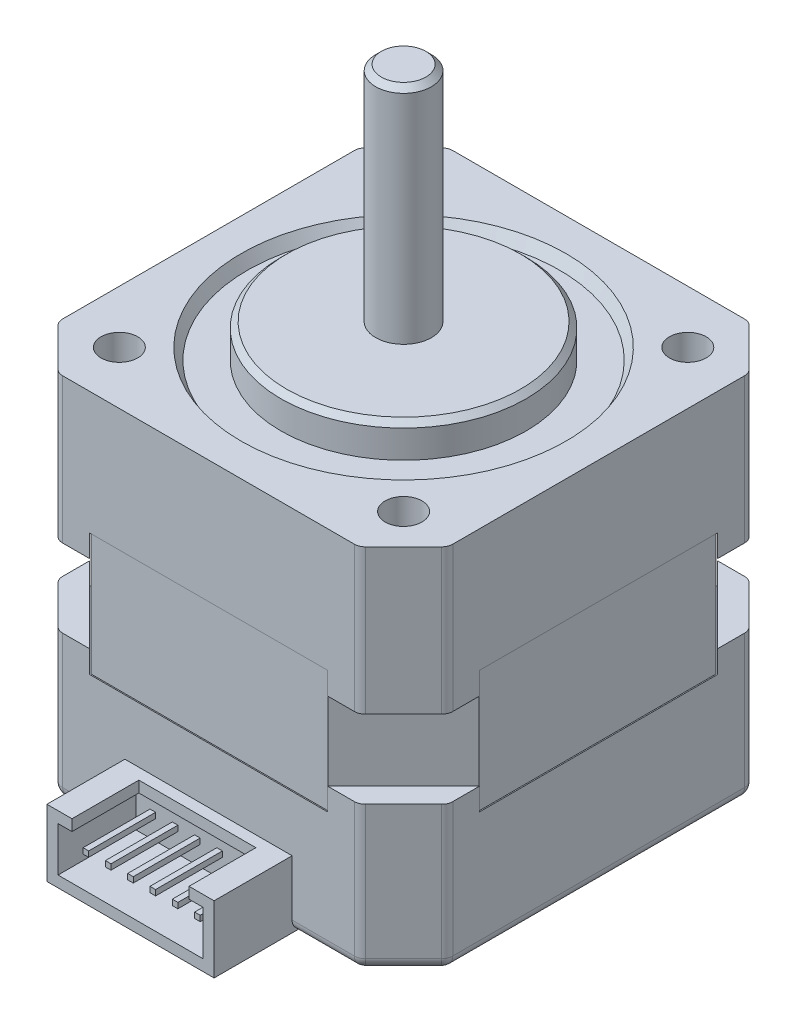
from build123d import *

# Parameters (mm, degrees)
EXTRUDE1_START       = -16.5
SKETCH1_W            = 35
SKETCH1_H            = 35
EXTRUDE1_DEPTH       = 11
CHAMFER3_SIZE        = 4
EXTRUDE2_DEPTH       = 2
BOSS_EXTRUDE2_DEPTH  = 5.5
MIRROR3_START        = 5.5
MIRROR3_DEPTH        = 11
MIRROR3_START_2      = 3.5
MIRROR3_2_DEPTH      = 2
SKETCH14_R           = 1.65
CUT_EXTRUDE4_DEPTH   = 12
FILLET3_R            = 1
SKETCH18_R           = 4.5
CUT_EXTRUDE6_DEPTH   = 2
SKETCH19_R           = 11
BOSS_EXTRUDE5_DEPTH  = 2
CHAMFER4_SIZE        = 0.5
FILLET7_R            = 1
SKETCH17_R           = 3.5
CUT_EXTRUDE7_DEPTH   = 2
CUT_EXTRUDE8_START   = -1
SKETCH20_R           = 14
SKETCH20_R_2         = 11
CUT_EXTRUDE8_DEPTH   = 1
DRAFT1_ANGLE         = 30
SKETCH22_R           = 2.75
BOSS_EXTRUDE6_DEPTH  = 2
FILLET8_R            = 1
SKETCH23_R           = 2.5
BOSS_EXTRUDE7_DEPTH  = 20
CHAMFER5_SIZE        = 0.5
SKETCH24_W           = 15
SKETCH24_H           = 6
SKETCH24_W_2         = 13
SKETCH24_H_2         = 4
BOSS_EXTRUDE10_DEPTH = 7
SKETCH25_W           = 0.5
SKETCH25_H           = 0.5
BOSS_EXTRUDE11_DEPTH = 6
SKETCH26_W           = 10.5
SKETCH26_H           = 1
CUT_EXTRUDE9_DEPTH   = 6


# Read off the part's stored shape, not the designer's step: Mirror3
with BuildPart() as part:
    # Sketch1 → Extrude1 (new body)
    with BuildSketch(Plane(origin=(0, 0, 0), x_dir=(1, 0, 0), z_dir=(0, 1, 0)).offset(EXTRUDE1_START)):
        Rectangle(SKETCH1_W, SKETCH1_H)
    extrude(amount=EXTRUDE1_DEPTH)

    # Chamfer3
    chamfer3_edges = [part.edges().sort_by_distance(p)[0] for p in [
        (-17.5, -11, -17.5),
        (17.5, -11, -17.5),
        (17.5, -11, 17.5),
        (-17.5, -11, 17.5),
    ]]
    chamfer(chamfer3_edges, length=CHAMFER3_SIZE)

    # Sketch2 → Extrude2 (add)
    with BuildSketch(Plane(origin=(0, -5.5, 0), x_dir=(-1, 0, 0), z_dir=(0, 1, 0))):
        Polygon((-17.5, -13.5), (-13.5, -17.5), (-10.671572875, -17.5), (-17.5, -10.671572875), align=None)
        Polygon((17.5, -13.5), (17.5, -10.671572875), (10.671572875, -17.5), (13.5, -17.5), align=None)
        Polygon((17.5, 13.5), (13.5, 17.5), (10.671572875, 17.5), (17.5, 10.671572875), align=None)
        Polygon((-17.5, 13.5), (-17.5, 10.671572875), (-10.671572875, 17.5), (-13.5, 17.5), align=None)
    extrude(amount=EXTRUDE2_DEPTH)

    # Sketch12 → Boss-Extrude2 (add, symmetric)
    with BuildSketch(Plane(origin=(0, 0, 0), x_dir=(1, 0, 0), z_dir=(0, 1, 0))):
        Polygon((-10.630151519, -17.4), (10.630151519, -17.4), (17.4, -10.630151519), (17.4, 10.630151519), (10.630151519, 17.4), (-10.630151519, 17.4), (-17.4, 10.630151519), (-17.4, -10.630151519), align=None)
    extrude(amount=BOSS_EXTRUDE2_DEPTH, both=True)

    # Mirror3 outline → Mirror3 (add)
    with BuildSketch(Plane(origin=(0, 0, 0), x_dir=(1, 0, 0), z_dir=(0, 1, 0)).offset(MIRROR3_START)):
        Polygon((-13.5, 17.5), (-17.5, 13.5), (-17.5, -13.5), (-13.5, -17.5), (13.5, -17.5), (17.5, -13.5), (17.5, 13.5), (13.5, 17.5), align=None)
    extrude(amount=MIRROR3_DEPTH)

    # Mirror3 2 outline → Mirror3 2 (add)
    with BuildSketch(Plane(origin=(0, 0, 0), x_dir=(1, 0, 0), z_dir=(0, 1, 0)).offset(MIRROR3_START_2)):
        Polygon((-13.5, 17.5), (-17.5, 13.5), (-17.5, 10.671572875), (-10.671572875, 17.5), align=None)
        Polygon((-10.671572875, -17.5), (-17.5, -10.671572875), (-17.5, -13.5), (-13.5, -17.5), align=None)
        Polygon((13.5, 17.5), (10.671572875, 17.5), (17.5, 10.671572875), (17.5, 13.5), align=None)
        Polygon((17.5, -10.671572875), (10.671572875, -17.5), (13.5, -17.5), (17.5, -13.5), align=None)
    extrude(amount=MIRROR3_2_DEPTH)

    # Sketch14 → Cut-Extrude4 (cut)
    with BuildSketch(Plane(origin=(0, 16.5, 0), x_dir=(1, 0, 0), z_dir=(0, 1, 0))):
        with Locations(Location((-12.75, 12.75, 0), (0, 0, 270))):
            Circle(SKETCH14_R)
        with Locations(Location((12.75, 12.75, 0), (0, 0, 270))):
            Circle(SKETCH14_R)
        with Locations(Location((12.75, -12.75, 0), (0, 0, 270))):
            Circle(SKETCH14_R)
        with Locations(Location((-12.75, -12.75, 0), (0, 0, 270))):
            Circle(SKETCH14_R)
    extrude(amount=-CUT_EXTRUDE4_DEPTH, mode=Mode.SUBTRACT)

    # Fillet3
    fillet3_edges = [part.edges().sort_by_distance(p)[0] for p in [
        (-13.5, 10, 17.5),
        (13.5, 10, 17.5),
        (17.5, 10, -13.5),
        (17.5, 10, 13.5),
        (-17.5, 10, -13.5),
        (-17.5, 10, 13.5),
        (-13.5, 10, -17.5),
        (13.5, 10, -17.5),
        (17.5, -10, -13.5),
        (17.5, -10, 13.5),
        (-13.5, -10, 17.5),
        (13.5, -10, 17.5),
        (-17.5, -10, -13.5),
        (-17.5, -10, 13.5),
        (-13.5, -10, -17.5),
        (13.5, -10, -17.5),
    ]]
    fillet(fillet3_edges, radius=FILLET3_R)

    # Sketch18 → Cut-Extrude6 (cut)
    with BuildSketch(Plane.XZ.offset(16.5)):
        with Locations(Location((0, 0, 0), (0, 0, 270))):
            Circle(SKETCH18_R)
    extrude(amount=-CUT_EXTRUDE6_DEPTH, mode=Mode.SUBTRACT)

    # Sketch19 → Boss-Extrude5 (add)
    with BuildSketch(Plane(origin=(0, 16.5, 0), x_dir=(1, 0, 0), z_dir=(0, 1, 0))):
        with Locations(Location((0, 0, 0), (0, 0, 90))):
            Circle(SKETCH19_R)
    extrude(amount=BOSS_EXTRUDE5_DEPTH)

    # Chamfer4
    chamfer4_edges = [part.edges().sort_by_distance(p)[0] for p in [
        (0, 18.5, 11),
    ]]
    chamfer(chamfer4_edges, length=CHAMFER4_SIZE)

    # Fillet7
    fillet7_edges = [part.edges().sort_by_distance(p)[0] for p in [
        (-17.5, -16.5, 0),
        (-15.5, -16.5, 15.5),
        (17.5, -16.5, 0),
        (15.5, -16.5, 15.5),
        (0, -16.5, 17.5),
        (-15.5, -16.5, -15.5),
        (0, -16.5, -17.5),
        (15.5, -16.5, -15.5),
        (-17.423879533, -16.5, -13.46846987),
        (-13.46846987, -16.5, -17.423879533),
        (13.46846987, -16.5, -17.423879533),
        (17.423879533, -16.5, -13.46846987),
        (17.423879533, -16.5, 13.46846987),
        (13.46846987, -16.5, 17.423879533),
        (-13.46846987, -16.5, 17.423879533),
        (-17.423879533, -16.5, 13.46846987),
    ]]
    fillet(fillet7_edges, radius=FILLET7_R)

    # Sketch17 → Cut-Extrude7 (cut)
    with BuildSketch(Plane.XZ.offset(16.5)):
        with Locations(Location((-12.75, 12.75, 0), (0, 0, 270))):
            Circle(SKETCH17_R)
        with Locations(Location((12.75, 12.75, 0), (0, 0, 270))):
            Circle(SKETCH17_R)
        with Locations(Location((12.75, -12.75, 0), (0, 0, 270))):
            Circle(SKETCH17_R)
        with Locations(Location((-12.75, -12.75, 0), (0, 0, 270))):
            Circle(SKETCH17_R)
    extrude(amount=-CUT_EXTRUDE7_DEPTH, mode=Mode.SUBTRACT)

    # Sketch20 → Cut-Extrude8 (cut)
    with BuildSketch(Plane(origin=(0, 16.5, 0), x_dir=(1, 0, 0), z_dir=(0, 1, 0)).offset(CUT_EXTRUDE8_START)):
        with Locations(Location((0, 0, 0), (0, 0, 270))):
            Circle(SKETCH20_R)
        with Locations(Location((0, 0, 0), (0, 0, 270))):
            Circle(SKETCH20_R_2, mode=Mode.SUBTRACT)
    extrude(amount=CUT_EXTRUDE8_DEPTH, mode=Mode.SUBTRACT)

    # Draft1
    draft1_faces = [part.faces().sort_by_distance(p)[0] for p in [
        (0, 16, -14),
    ]]
    draft(draft1_faces, Plane.ZX.offset(15.5), DRAFT1_ANGLE)

    # Sketch22 → Boss-Extrude6 (add)
    with BuildSketch(Plane.XZ.offset(14.5)):
        with Locations(Location((-12.75, 12.75, 0), (0, 0, 270))):
            Circle(SKETCH22_R)
        with Locations(Location((-12.75, -12.75, 0), (0, 0, 270))):
            Circle(SKETCH22_R)
        with Locations(Location((12.75, 12.75, 0), (0, 0, 270))):
            Circle(SKETCH22_R)
        with Locations(Location((12.75, -12.75, 0), (0, 0, 270))):
            Circle(SKETCH22_R)
    extrude(amount=BOSS_EXTRUDE6_DEPTH)

    # Fillet8
    fillet8_edges = [part.edges().sort_by_distance(p)[0] for p in [
        (-12.75, -16.5, 15.5),
        (-12.75, -16.5, -10),
        (12.75, -16.5, 15.5),
        (12.75, -16.5, -10),
    ]]
    fillet(fillet8_edges, radius=FILLET8_R)

    # Sketch23 → Boss-Extrude7 (add)
    with BuildSketch(Plane(origin=(0, 18.5, 0), x_dir=(1, 0, 0), z_dir=(0, 1, 0))):
        with Locations(Location((0, 0, 0), (0, 0, 270))):
            Circle(SKETCH23_R)
    extrude(amount=BOSS_EXTRUDE7_DEPTH)

    # Chamfer5
    chamfer5_edges = [part.edges().sort_by_distance(p)[0] for p in [
        (0, 38.5, -2.5),
    ]]
    chamfer(chamfer5_edges, length=CHAMFER5_SIZE)

    # Sketch24 → Boss-Extrude10 (add, symmetric)
    with BuildSketch(Plane.XY.offset(17.5)):
        with Locations((0, -13.5)):
            Rectangle(SKETCH24_W, SKETCH24_H)
        with Locations((0, -13.5)):
            Rectangle(SKETCH24_W_2, SKETCH24_H_2, mode=Mode.SUBTRACT)
    extrude(amount=BOSS_EXTRUDE10_DEPTH, both=True)

    # Sketch25 → Boss-Extrude11 (add)
    with BuildSketch(Plane.XY.offset(17.5)):
        with Locations((-3, -13.5)):
            Rectangle(SKETCH25_W, SKETCH25_H)
        with Locations((-5, -13.5)):
            Rectangle(SKETCH25_W, SKETCH25_H)
        with Locations((-1, -13.5)):
            Rectangle(SKETCH25_W, SKETCH25_H)
        with Locations((1, -13.5)):
            Rectangle(SKETCH25_W, SKETCH25_H)
        with Locations((3, -13.5)):
            Rectangle(SKETCH25_W, SKETCH25_H)
        with Locations((5, -13.5)):
            Rectangle(SKETCH25_W, SKETCH25_H)
    extrude(amount=BOSS_EXTRUDE11_DEPTH)

    # Sketch26 → Cut-Extrude9 (cut)
    with BuildSketch(Plane.XY.offset(24.5)):
        with Locations((0, -11)):
            Rectangle(SKETCH26_W, SKETCH26_H)
    extrude(amount=-CUT_EXTRUDE9_DEPTH, mode=Mode.SUBTRACT)


solid = part.part
